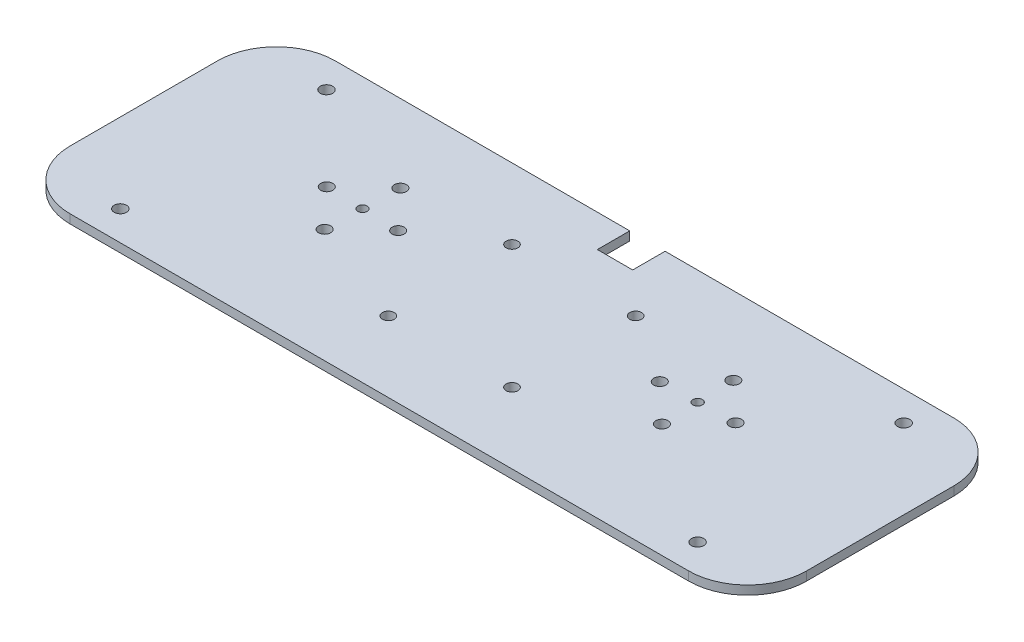
from build123d import *

# Parameters (mm, degrees)
SKETCH_1_W          = 250
SKETCH_1_H          = 3
EXTRUDE_1_DEPTH     = 45
SKETCH_2_R          = 2
CUT_EXTRUDE_1_DEPTH = 133.887170186
FILLET_1_R          = 20
SKETCH_4_R          = 2.1
CUT_EXTRUDE_3_DEPTH = 10
SKETCH_5_R          = 2.05
CUT_EXTRUDE_4_DEPTH = 4
SKETCH_6_R          = 1.6
CUT_EXTRUDE_5_DEPTH = 4
SKETCH_7_W          = 12
SKETCH_7_H          = 11
CUT_EXTRUDE_6_DEPTH = 20


with BuildPart() as part:
    # 草图1 → 凸台-拉伸1 (new, symmetric)
    with BuildSketch(Plane.XY):
        Rectangle(SKETCH_1_W, SKETCH_1_H)
    extrude(amount=EXTRUDE_1_DEPTH, both=True)

    # 草图2 → 切除-拉伸1 (cut, through all)
    with BuildSketch(Plane(origin=(0, 1.5, 0), x_dir=(1, 0, 0), z_dir=(0, 1, 0))):
        with Locations((-21, 21)):
            Circle(SKETCH_2_R)
        with Locations((21, 21)):
            Circle(SKETCH_2_R)
        with Locations((21, -21)):
            Circle(SKETCH_2_R)
        with Locations((-21, -21)):
            Circle(SKETCH_2_R)
    extrude(amount=-CUT_EXTRUDE_1_DEPTH, mode=Mode.SUBTRACT)

    # 圆角1
    fillet_1_edges = [part.edges().sort_by_distance(p)[0] for p in [
        (125, 0, 45),
        (-125, 0, 45),
        (-125, 0, -45),
        (125, 0, -45),
    ]]
    fillet(fillet_1_edges, radius=FILLET_1_R)

    # 草图4 → 切除-拉伸3 (cut)
    with BuildSketch(Plane.XZ.offset(1.5)):
        with Locations((-98, -35)):
            Circle(SKETCH_4_R)
        with Locations((-98, 35)):
            Circle(SKETCH_4_R)
        with Locations((98, 35)):
            Circle(SKETCH_4_R)
        with Locations((98, -35)):
            Circle(SKETCH_4_R)
    extrude(amount=-CUT_EXTRUDE_3_DEPTH, mode=Mode.SUBTRACT)

    # 草图5 → 切除-拉伸4 (cut)
    with BuildSketch(Plane.XZ.offset(1.5)):
        with Locations((57.273087281, 6.359345731)):
            Circle(SKETCH_5_R)
        with Locations((69.398377233, -6.504454003)):
            Circle(SKETCH_5_R)
        with Locations((44.409287547, -5.765944221)):
            Circle(SKETCH_5_R)
        with Locations((56.534577499, -18.629743954)):
            Circle(SKETCH_5_R)
    cut_extrude_4 = extrude(amount=-CUT_EXTRUDE_4_DEPTH, mode=Mode.SUBTRACT)

    # 草图6 → 切除-拉伸5 (cut)
    with BuildSketch(Plane(origin=(0, 1.5, 0), x_dir=(1, 0, 0), z_dir=(0, 1, 0))):
        with Locations((56.90383239, 6.135199112)):
            Circle(SKETCH_6_R)
    cut_extrude_5 = extrude(amount=-CUT_EXTRUDE_5_DEPTH, mode=Mode.SUBTRACT)

    # 镜向1: 切除-拉伸4, 切除-拉伸5 across plane
    add(cut_extrude_4.mirror(Plane(origin=(0, 0, 0), x_dir=(0, 0, 1), z_dir=(1, 0, 0))), mode=Mode.SUBTRACT)
    add(cut_extrude_5.mirror(Plane(origin=(0, 0, 0), x_dir=(0, 0, 1), z_dir=(1, 0, 0))), mode=Mode.SUBTRACT)

    # 草图7 → 切除-拉伸6 (cut)
    with BuildSketch(Plane(origin=(0, 1.5, 0), x_dir=(1, 0, 0), z_dir=(0, 1, 0))):
        with Locations((0.979902634, 39.5)):
            Rectangle(SKETCH_7_W, SKETCH_7_H)
    extrude(amount=-CUT_EXTRUDE_6_DEPTH, mode=Mode.SUBTRACT)


solid = part.part
